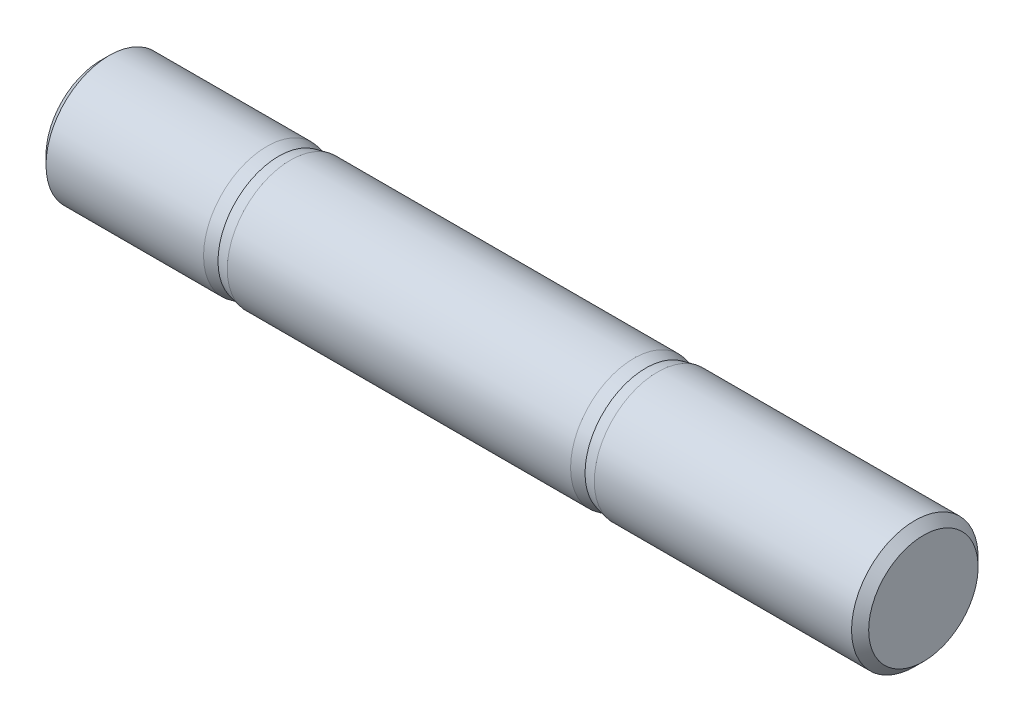
from build123d import *

# Parameters (mm, degrees)
HEADCHAMFER_SIZE = 1.353


with BuildPart() as part:
    # Sketch1 → BaseHead (revolve)
    with BuildSketch(Plane.XY):
        Polygon((0, 0), (0, 10), (26.25, 10), (30, 9.188), (84.25, 9.188), (88, 10), (130, 10), (130, 0), align=None)
    revolve(axis=Axis((-1.310841664, 0, 0), (1, 0, 0)))

    # HeadChamfer
    headchamfer_edges = [part.edges().sort_by_distance(p)[0] for p in [
        (0, -10, 0),
        (130, -10, 0),
    ]]
    chamfer(headchamfer_edges, length=HEADCHAMFER_SIZE)

    # Sketch2 → BaseBody (revolve)
    with BuildSketch(Plane.XY):
        Polygon((26.25, 9.188), (30, 10), (84.25, 10), (88, 9.188), align=None)
    revolve(axis=Axis((-1.310841664, 0, 0), (1, 0, 0)))


solid = part.part
